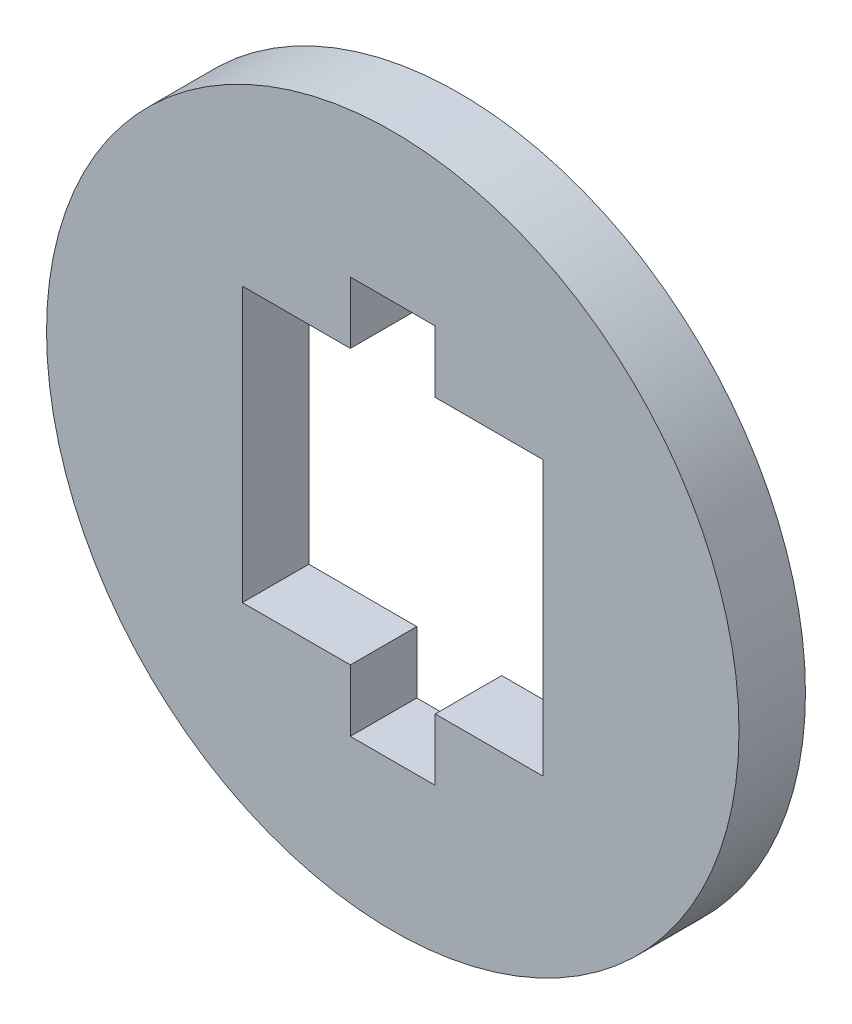
from build123d import *

# Parameters (mm, degrees)
SKETCH1_R           = 52.105052161
BOSS_EXTRUDE1_DEPTH = 10
SKETCH2_W           = 45.263653378
SKETCH2_H           = 41.248329288
CUT_EXTRUDE1_DEPTH  = 75.363115328
SKETCH3_W           = 12.776031196
SKETCH3_H           = 59.864831888
CUT_EXTRUDE2_DEPTH  = 75.363115328


with BuildPart() as part:
    # Sketch1 → Boss-Extrude1 (new body)
    with BuildSketch(Plane.XY):
        Circle(SKETCH1_R)
    extrude(amount=BOSS_EXTRUDE1_DEPTH)

    # Sketch2 → Cut-Extrude1 (cut, through all)
    with BuildSketch(Plane.XY.offset(10)):
        Rectangle(SKETCH2_W, SKETCH2_H)
    extrude(amount=-CUT_EXTRUDE1_DEPTH, mode=Mode.SUBTRACT)

    # Sketch3 → Cut-Extrude2 (cut, through all)
    with BuildSketch(Plane.XY.offset(10)):
        Rectangle(SKETCH3_W, SKETCH3_H)
    extrude(amount=-CUT_EXTRUDE2_DEPTH, mode=Mode.SUBTRACT)


solid = part.part
